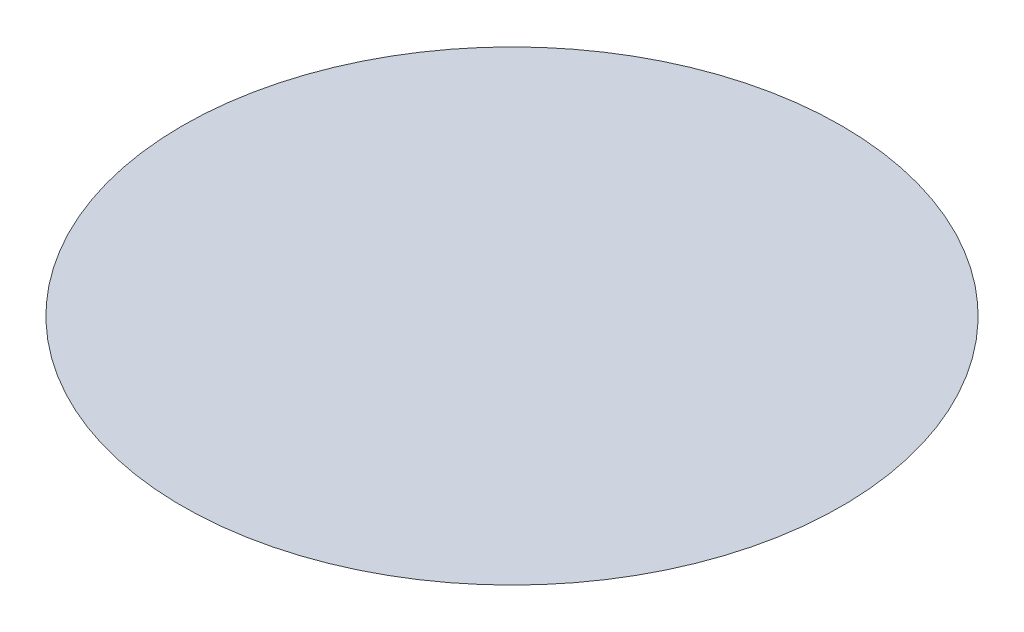
from build123d import *


with BuildPart() as part:
    # Sketch1 → Revolve1 (revolve)
    with BuildSketch(Plane.XY):
        with BuildLine():
            Line((0, 0), (0, 28))
            Line((0, 28), (102.065665138, 28))
            ThreePointArc((102.065665138, 28), (52.918333307, 7.126968323), (0, 0))
        make_face()
    revolve(axis=Axis((0, 0, 0), (0, 1, 0)))


solid = part.part
